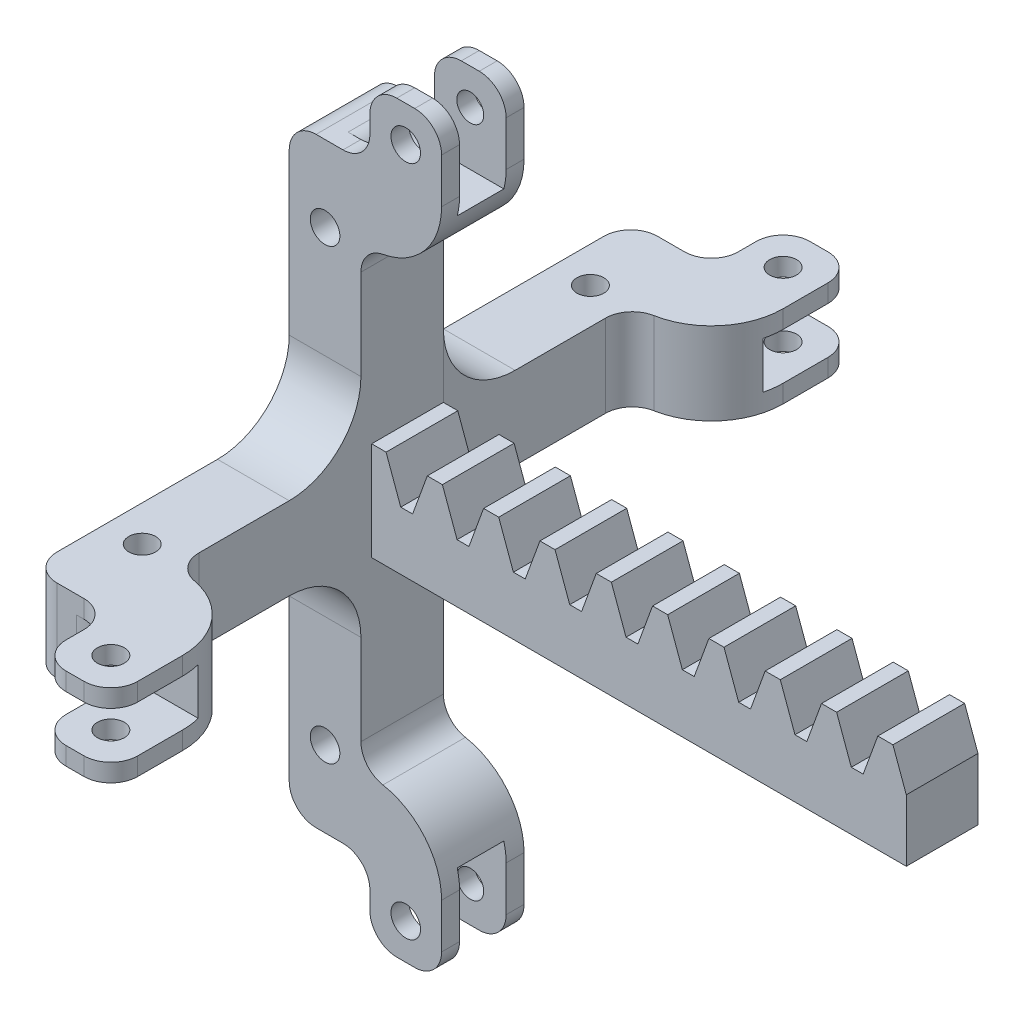
from build123d import *

# Parameters (mm, degrees)
SKETCH_1_W             = 188.495559215
SKETCH_1_H             = 10
EXTRUDE_1_DEPTH        = 5
EXTRUDE_2_DEPTH        = 5
PATTERN_LINEAR_1_COUNT = 30
PATTERN_LINEAR_1_PITCH = 6.283185307
EXTRUDE_1_2_DEPTH      = 3
SKETCH_5_W             = 188.495559215
SKETCH_5_H             = 8
CUT_EXTRUDE_1_DEPTH    = 3.5
SKETCH_6_W             = 1.321741482
SKETCH_6_H             = 6.5
CUT_EXTRUDE_2_DEPTH    = 8
SKETCH_7_W             = 8
SKETCH_7_H             = 67
EXTRUDE_2_2_DEPTH      = 8
SKETCH_8_W             = 8
SKETCH_8_H             = 67
EXTRUDE_3_DEPTH        = 1.2
SKETCH_9_R             = 1.65
CUT_EXTRUDE_3_DEPTH    = 47
SKETCH_11_W            = 90
SKETCH_11_H            = 19.43134898
CUT_EXTRUDE_5_DEPTH    = 18.5
SKETCH_12_W            = 29.528013561
SKETCH_12_H            = 12.520960887
CUT_EXTRUDE_6_DEPTH    = 18.5
FILLET_1_R             = 3
EXTRUDE_START          = -9.2
EXTRUDE_5_DEPTH        = 9.2
SKETCH_14_R            = 1.65
CUT_EXTRUDE_7_DEPTH    = 10
FILLET_2_R             = 8
FILLET_3_R             = 3
SKETCH_15_W            = 12.861039222
SKETCH_15_H            = 5.2
CUT_EXTRUDE_8_DEPTH    = 10
FILLET_4_R             = 2
FILLET_5_R             = 2
SKETCH_16_W            = 10
SKETCH_16_H            = 5.2
CUT_EXTRUDE_9_DEPTH    = 10
FILLET_6_R             = 3
FILLET_7_R             = 3
EXTRUDE_START_2        = -2
SKETCH_17_R            = 1.65
SKETCH_17_R_2          = 1.5
EXTRUDE_6_DEPTH        = 2
SKETCH_18_W            = 67
SKETCH_18_H            = 9.2
EXTRUDE_7_DEPTH        = 8
EXTRUDE_8_REACH        = 114.681
SKETCH_20_W            = 44.135426651
SKETCH_20_H            = 50.490607697
SKETCH_20_W_2          = 28.186667644
SKETCH_20_H_2          = 40.719184925
CUT_EXTRUDE_10_DEPTH   = 33
SKETCH_21_R            = 1.5
CUT_EXTRUDE_11_DEPTH   = 33
SKETCH_22_W            = 10
SKETCH_22_H            = 5.2
CUT_EXTRUDE_12_DEPTH   = 10
SKETCH_23_W            = 9
SKETCH_23_H            = 5.2
CUT_EXTRUDE_13_DEPTH   = 10
FILLET_8_R             = 3
FILLET_9_R             = 3
FILLET_10_R            = 8
FILLET_11_R            = 3
FILLET_12_R            = 8
SKETCH_24_R            = 1.5
CUT_EXTRUDE_14_DEPTH   = 10
FILLET_13_R            = 3


with BuildPart() as part:
    # 草图1 → Extrude 1 (new body)
    with BuildSketch(Plane.XY):
        with Locations((94.247779608, -5)):
            Rectangle(SKETCH_1_W, SKETCH_1_H)
    extrude(amount=EXTRUDE_1_DEPTH)

    # 草图2 → Extrude 2 (add)
    with BuildSketch(Plane.XY.offset(5)):
        Polygon((0, 0), (1.637866054, 4.5), (3.323577771, 4.5), (4.961443825, 0), align=None)
    extrude_2 = extrude(amount=-EXTRUDE_2_DEPTH)

    # 阵列(线性)1: Extrude 2 ×30
    with Locations(*[(i * PATTERN_LINEAR_1_PITCH, 0, 0) for i in range(1, PATTERN_LINEAR_1_COUNT)]):
        add(extrude_2)

    # 草图3 → Extrude 1 2 (add)
    with BuildSketch(Plane(origin=(188.495559215, -10, 0), x_dir=(-1, 0, 0), z_dir=(0, 0, -1))):
        Polygon((188.495559215, 0), (188.495559215, 10), (186.857693161, 14.5), (185.171981445, 14.5), (183.53411539, 10), (182.212373908, 10), (180.574507854, 14.5), (178.888796137, 14.5), (177.250930083, 10), (175.929188601, 10), (174.291322547, 14.5), (172.60561083, 14.5), (170.967744776, 10), (169.646003294, 10), (168.00813724, 14.5), (166.322425523, 14.5), (164.684559469, 10), (163.362817987, 10), (161.724951932, 14.5), (160.039240216, 14.5), (158.401374162, 10), (157.079632679, 10), (155.441766625, 14.5), (153.756054909, 14.5), (152.118188855, 10), (150.796447372, 10), (149.158581318, 14.5), (147.472869602, 14.5), (145.835003547, 10), (144.513262065, 10), (142.875396011, 14.5), (141.189684294, 14.5), (139.55181824, 10), (138.230076758, 10), (136.592210704, 14.5), (134.906498987, 14.5), (133.268632933, 10), (131.946891451, 10), (130.309025397, 14.5), (128.62331368, 14.5), (126.985447626, 10), (125.663706144, 10), (124.025840089, 14.5), (122.340128373, 14.5), (120.702262319, 10), (119.380520836, 10), (117.742654782, 14.5), (116.056943066, 14.5), (114.419077011, 10), (113.097335529, 10), (111.459469475, 14.5), (109.773757759, 14.5), (108.135891704, 10), (106.814150222, 10), (105.176284168, 14.5), (103.490572451, 14.5), (101.852706397, 10), (100.530964915, 10), (98.893098861, 14.5), (97.207387144, 14.5), (95.56952109, 10), (94.247779608, 10), (92.609913553, 14.5), (90.924201837, 14.5), (89.286335783, 10), (87.964594301, 10), (86.326728246, 14.5), (84.64101653, 14.5), (83.003150476, 10), (81.681408993, 10), (80.043542939, 14.5), (78.357831223, 14.5), (76.719965168, 10), (75.398223686, 10), (73.760357632, 14.5), (72.074645915, 14.5), (70.436779861, 10), (69.115038379, 10), (67.477172325, 14.5), (65.791460608, 14.5), (64.153594554, 10), (62.831853072, 10), (61.193987018, 14.5), (59.508275301, 14.5), (57.870409247, 10), (56.548667765, 10), (54.91080171, 14.5), (53.225089994, 14.5), (51.58722394, 10), (50.265482457, 10), (48.627616403, 14.5), (46.941904687, 14.5), (45.304038633, 10), (43.98229715, 10), (42.344431096, 14.5), (40.65871938, 14.5), (39.020853325, 10), (37.699111843, 10), (36.061245789, 14.5), (34.375534072, 14.5), (32.737668018, 10), (31.415926536, 10), (29.778060482, 14.5), (28.092348765, 14.5), (26.454482711, 10), (25.132741229, 10), (23.494875175, 14.5), (21.809163458, 14.5), (20.171297404, 10), (18.849555922, 10), (17.211689867, 14.5), (15.525978151, 14.5), (13.888112097, 10), (12.566370614, 10), (10.92850456, 14.5), (9.242792844, 14.5), (7.604926789, 10), (6.283185307, 10), (4.645319253, 14.5), (2.959607536, 14.5), (1.321741482, 10), (0, 10), (0, 0), align=None)
    extrude(amount=EXTRUDE_1_2_DEPTH)

    # 草图5 → 切除-拉伸1 (cut)
    with BuildSketch(Plane.XZ.offset(10)):
        with Locations((94.247779608, 1)):
            Rectangle(SKETCH_5_W, SKETCH_5_H)
    extrude(amount=-CUT_EXTRUDE_1_DEPTH, mode=Mode.SUBTRACT)

    # 草图6 → 切除-拉伸2 (cut)
    with BuildSketch(Plane(origin=(0, 0, -3), x_dir=(-1, 0, 0), z_dir=(0, 0, -1))):
        with Locations((-187.834688474, -3.25)):
            Rectangle(SKETCH_6_W, SKETCH_6_H)
    extrude(amount=-CUT_EXTRUDE_2_DEPTH, mode=Mode.SUBTRACT)

    # 草图7 → Extrude 2 2 (add)
    with BuildSketch(Plane.ZY):
        with Locations((1, -1)):
            Rectangle(SKETCH_7_W, SKETCH_7_H)
    extrude(amount=-EXTRUDE_2_2_DEPTH)

    # 草图8 → 凸台-拉伸3 (add)
    with BuildSketch(Plane.XY.offset(5)):
        with Locations((4, -1)):
            Rectangle(SKETCH_8_W, SKETCH_8_H)
    extrude(amount=EXTRUDE_3_DEPTH)

    # 草图9 → 切除-拉伸3 (cut)
    with BuildSketch(Plane.XY.offset(6.2)):
        with Locations((4, 24)):
            Circle(SKETCH_9_R)
        with Locations(Location((4, -26, 0), (0, 0, 180))):
            Circle(SKETCH_9_R)
    extrude(amount=-CUT_EXTRUDE_3_DEPTH, mode=Mode.SUBTRACT)

    # 草图11 → 切除-拉伸5 (cut)
    with BuildSketch(Plane.XY.offset(5)):
        with Locations((142.173817733, 3.21567449)):
            Rectangle(SKETCH_11_W, SKETCH_11_H)
    extrude(amount=-CUT_EXTRUDE_5_DEPTH, mode=Mode.SUBTRACT)

    # 草图12 → 切除-拉伸6 (cut)
    with BuildSketch(Plane.XY.offset(5)):
        with Locations((82.409810953, -0.239519556)):
            Rectangle(SKETCH_12_W, SKETCH_12_H)
    extrude(amount=-CUT_EXTRUDE_6_DEPTH, mode=Mode.SUBTRACT)

    # 圆角1
    fillet_1_edges = [part.edges().sort_by_distance(p)[0] for p in [
        (0, 32.5, 1.6),
        (8, -34.5, 1.6),
        (8, 32.5, 1.6),
        (0, -34.5, 1.6),
    ]]
    fillet(fillet_1_edges, radius=FILLET_1_R)

    # 草图13 → 凸台-拉伸5 (add)
    with BuildSketch(Plane.XY.offset(6.2).offset(EXTRUDE_START)):
        with BuildLine():
            Line((5, 32.5), (9, 32.5))
            Line((9, 32.5), (9, 40.5))
            Line((9, 40.5), (17, 40.5))
            Line((17, 40.5), (17, 24.5))
            Line((17, 24.5), (8, 24.5))
            Line((8, 24.5), (8, 29.5))
            ThreePointArc((8, 29.5), (7.121320344, 31.621320344), (5, 32.5))
        make_face()
        with BuildLine():
            Line((8, -31.5), (8, -26.5))
            Line((8, -26.5), (17, -26.5))
            Line((17, -26.5), (17, -42.5))
            Line((17, -42.5), (9, -42.5))
            Line((9, -42.5), (9, -34.5))
            Line((9, -34.5), (5, -34.5))
            ThreePointArc((5, -34.5), (7.121320344, -33.621320344), (8, -31.5))
        make_face()
    extrude(amount=EXTRUDE_5_DEPTH)

    # 草图14 → 切除-拉伸7 (cut)
    with BuildSketch(Plane.XY.offset(6.2)):
        with Locations((13, 36.5)):
            Circle(SKETCH_14_R)
        with Locations(Location((13, -38.5, 0), (0, 0, 180))):
            Circle(SKETCH_14_R)
    extrude(amount=-CUT_EXTRUDE_7_DEPTH, mode=Mode.SUBTRACT)

    # 圆角2
    fillet_2_edges = [part.edges().sort_by_distance(p)[0] for p in [
        (17, 24.5, 1.6),
        (17, -26.5, 1.6),
    ]]
    fillet(fillet_2_edges, radius=FILLET_2_R)

    # 圆角3
    fillet_3_edges = [part.edges().sort_by_distance(p)[0] for p in [
        (9, 32.5, 1.6),
        (9, 40.5, 1.6),
        (17, 40.5, 1.6),
        (8, 24.5, 1.6),
        (8, -26.5, 1.6),
        (9, -34.5, 1.6),
        (9, -42.5, 1.6),
        (17, -42.5, 1.6),
    ]]
    fillet(fillet_3_edges, radius=FILLET_3_R)

    # 草图15 → 切除-拉伸8 (cut)
    with BuildSketch(Plane(origin=(0, 40.5, 0), x_dir=(1, 0, 0), z_dir=(0, 1, 0))):
        with Locations((13, -1.6)):
            Rectangle(SKETCH_15_W, SKETCH_15_H)
    extrude(amount=-CUT_EXTRUDE_8_DEPTH, mode=Mode.SUBTRACT)

    # 圆角4
    # the kernel refuses this fillet: 2 mm, written as the material it takes off along each edge
    with BuildSketch(Plane(origin=(6.569480389, 32.554547219, -1), x_dir=(-0.9996282824782214, -0.02726347134245878, 0), z_dir=(0, 0, 1))) as fillet_4_piece_1:
        with BuildLine():
            CenterArc((2.055270654, 1.999256565), FILLET_4_R, 178.437724577, 90)
            Line((0.056014089, 2.053783508), (-0.143911567, 2.059236202))
            Line((-0.143911567, 2.059236202), (-0.199925656, 0.005452694))
            Line((-0.199925656, 0.005452694), (0.032597696, -0.197325594))
            ThreePointArc((0.032597696, -0.197325594), (0.565303156, -0.160924726), (1.995291017, -0.199925656))
            Line((1.995291017, -0.199925656), (2.000743711, 0))
        make_face()
    extrude(amount=5.2, mode=Mode.SUBTRACT)

    # 圆角5
    fillet_5_edges = [part.edges().sort_by_distance(p)[0] for p in [
        (6.569480389, 30.5, 1.6),
    ]]
    fillet(fillet_5_edges, radius=FILLET_5_R)

    # 草图16 → 切除-拉伸9 (cut)
    with BuildSketch(Plane.XZ.offset(42.5)):
        with Locations((13, 1.6)):
            Rectangle(SKETCH_16_W, SKETCH_16_H)
    extrude(amount=-CUT_EXTRUDE_9_DEPTH, mode=Mode.SUBTRACT)

    # 圆角6
    # the kernel refuses this fillet: 3 mm, written as the material it takes off along each edge
    with BuildSketch(Plane(origin=(8, -35.263932023, -1), x_dir=(-0.9654070298529217, 0.2607475152528977, 0), z_dir=(0, 0, 1))) as fillet_6_piece_1:
        with BuildLine():
            CenterArc((3.712019352, -2.89622109), FILLET_6_R, 105.114421668, 70.528779366)
            Line((0.720688407, -2.668319405), (0.421555313, -2.645529236))
            ThreePointArc((0.421555313, -2.645529236), (0.070722095, -1.412383957), (-0.289622109, -0.078224255))
            Line((-0.289622109, -0.078224255), (0.134776489, 0.268021078))
            ThreePointArc((0.134776489, 0.268021078), (2.051783182, 0.073611795), (2.851552552, 0.289622109))
            Line((2.851552552, 0.289622109), (2.929776806, 0))
        make_face()
    extrude(amount=5.2, mode=Mode.SUBTRACT)

    # 圆角7
    fillet_7_edges = [part.edges().sort_by_distance(p)[0] for p in [
        (8, -32.5, 1.6),
    ]]
    fillet(fillet_7_edges, radius=FILLET_7_R)

    # 草图17 → 凸台-拉伸6 (add)
    # profile 1 of 2: a face of its own
    with BuildSketch(Plane(origin=(0, 0, -3), x_dir=(-1, 0, 0), z_dir=(0, 0, -1)).offset(EXTRUDE_START_2)):
        with Locations(Location((-13, -38.5, 0), (0, 0, 180))):
            Circle(SKETCH_17_R)
        with Locations((-13, -38.5)):
            Circle(SKETCH_17_R_2, mode=Mode.SUBTRACT)
    # profile 2 of 2: a face of its own
    with BuildSketch(Plane(origin=(0, 0, -3), x_dir=(-1, 0, 0), z_dir=(0, 0, -1)).offset(EXTRUDE_START_2)):
        with Locations(Location((-13, 36.5, 0), (0, 0, 180))):
            Circle(SKETCH_17_R)
        with Locations((-13, 36.5)):
            Circle(SKETCH_17_R_2, mode=Mode.SUBTRACT)
    extrude(amount=EXTRUDE_6_DEPTH)

    # 草图18 → 凸台-拉伸7 (add)
    with BuildSketch(Plane.ZY):
        with Locations((1.6, -1)):
            Rectangle(SKETCH_18_W, SKETCH_18_H)
    extrude(amount=-EXTRUDE_7_DEPTH)

    # 凸台-拉伸8: up to this face of the body (flat: up to its plane)
    extrude_8_end = Plane(part.part.faces().sort_by_distance((4, 3.6, 20.65))[0])
    # 草图19 → 凸台-拉伸8 (add, up to the picked face)
    with BuildSketch(Plane.XZ.offset(42.5), mode=Mode.PRIVATE) as extrude_8_sk1:
        Polygon((9, -39.9), (17, -39.9), (17, -23.9), (9, -23.9), (8, -23.9), (8, -31.9), (9, -31.9), align=None)
    extrude_8_tool1 = split(extrude(extrude_8_sk1.sketch, amount=-EXTRUDE_8_REACH, mode=Mode.PRIVATE), bisect_by=extrude_8_end, keep=Keep.BOTH, mode=Mode.PRIVATE)
    # 草图19 → 凸台-拉伸8 (add, up to the picked face)
    with BuildSketch(Plane.XZ.offset(42.5), mode=Mode.PRIVATE) as extrude_8_sk2:
        Polygon((9, 35.1), (9, 43.1), (17, 43.1), (17, 27.1), (9, 27.1), (8, 27.1), (8, 35.1), align=None)
    extrude_8_tool2 = split(extrude(extrude_8_sk2.sketch, amount=-EXTRUDE_8_REACH, mode=Mode.PRIVATE), bisect_by=extrude_8_end, keep=Keep.BOTH, mode=Mode.PRIVATE)
    add(extrude_8_tool1.solids().sort_by(Axis((12.735294, -42.5, -31.664706), (0, 1, 0)))[0])
    add(extrude_8_tool2.solids().sort_by(Axis((12.735294, -42.5, 34.864706), (0, 1, 0)))[0])

    # 草图20 → 切除-拉伸10 (cut)
    with BuildSketch(Plane.ZY):
        with Locations((-45.967713326, -30.845303849)):
            Rectangle(SKETCH_20_W, SKETCH_20_H)
        with Locations((41.193333822, -25.959592463)):
            Rectangle(SKETCH_20_W_2, SKETCH_20_H_2)
    extrude(amount=-CUT_EXTRUDE_10_DEPTH, mode=Mode.SUBTRACT)

    # 草图21 → 切除-拉伸11 (cut)
    with BuildSketch(Plane.XZ.offset(5.6)):
        with Locations((13, 39.1)):
            Circle(SKETCH_21_R)
        with Locations(Location((13, -35.9, 0), (0, 0, 180))):
            Circle(SKETCH_21_R)
    extrude(amount=-CUT_EXTRUDE_11_DEPTH, mode=Mode.SUBTRACT)

    # 草图22 → 切除-拉伸12 (cut)
    with BuildSketch(Plane.XY.offset(43.1)):
        with Locations((13, -1)):
            Rectangle(SKETCH_22_W, SKETCH_22_H)
    extrude(amount=-CUT_EXTRUDE_12_DEPTH, mode=Mode.SUBTRACT)

    # 草图23 → 切除-拉伸13 (cut)
    with BuildSketch(Plane(origin=(0, 0, -39.9), x_dir=(-1, 0, 0), z_dir=(0, 0, -1))):
        with Locations((-12.5, -1)):
            Rectangle(SKETCH_23_W, SKETCH_23_H)
    extrude(amount=-CUT_EXTRUDE_13_DEPTH, mode=Mode.SUBTRACT)

    # 圆角8
    # the kernel refuses this fillet: 3 mm, written as the material it takes off along each edge
    with BuildSketch(Plane(origin=(8, 1.6, -31.9), x_dir=(-1, 0, 0), z_dir=(0, -1, 0))) as fillet_8_piece_1:
        with BuildLine():
            CenterArc((2.828427125, -3), FILLET_8_R, 90, 70.528779366)
            Line((0, -2), (0, 0))
            Line((0, 0), (2.828427125, 0))
        make_face()
    extrude(amount=5.2, mode=Mode.SUBTRACT)
    with BuildSketch(Plane(origin=(8, 1.6, 35.1), x_dir=(-1, 0, 0), z_dir=(0, -1, 0))) as fillet_8_piece_2:
        with BuildLine():
            CenterArc((2.828427125, 3), FILLET_8_R, 199.471220634, 70.528779366)
            Line((0, 2), (0, 0))
            Line((0, 0), (2.828427125, 0))
        make_face()
    extrude(amount=5.2, mode=Mode.SUBTRACT)
    with BuildSketch(Plane(origin=(9, -5.9, 43.1), x_dir=(0, 0, -1), z_dir=(0, 1, 0)), Plane(origin=(9, -13.1, 43.1), x_dir=(0, 0, -1), z_dir=(0, 1, 0)), Plane(origin=(17, -13.1, 43.1), x_dir=(-1, 0, 0), z_dir=(0, 1, 0)), Plane(origin=(17, -13.1, -39.9), x_dir=(0, 0, 1), z_dir=(0, 1, 0))) as fillet_8_piece_3:
        with BuildLine():
            CenterArc((FILLET_8_R, -FILLET_8_R), FILLET_8_R, 90, 90)
            Line((0, -FILLET_8_R), (0, 0))
            Line((0, 0), (FILLET_8_R, 0))
        make_face()
    extrude(amount=17, mode=Mode.SUBTRACT)
    with BuildSketch(Plane(origin=(17, -5.9, 43.1), x_dir=(0, 0, -1), z_dir=(0, 1, 0)), Plane(origin=(9, -5.9, -39.9), x_dir=(0, 0, 1), z_dir=(0, 1, 0)), Plane(origin=(9, -13.1, -39.9), x_dir=(0, 0, 1), z_dir=(0, 1, 0)), Plane(origin=(17, -5.9, -39.9), x_dir=(-1, 0, 0), z_dir=(0, 1, 0))) as fillet_8_piece_4:
        with BuildLine():
            CenterArc((FILLET_8_R, FILLET_8_R), FILLET_8_R, 180, 90)
            Line((0, FILLET_8_R), (0, 0))
            Line((0, 0), (FILLET_8_R, 0))
        make_face()
    extrude(amount=17, mode=Mode.SUBTRACT)
    with BuildSketch(Plane(origin=(0, -13.1, -31.9), x_dir=(0, 0, 1), z_dir=(0, 1, 0)), Plane(origin=(0, 11.1, 35.1), x_dir=(0, 0, -1), z_dir=(0, -1, 0))) as fillet_8_piece_5:
        with BuildLine():
            CenterArc((FILLET_8_R, FILLET_8_R), FILLET_8_R, 180, 90)
            Line((0, FILLET_8_R), (0, 0))
            Line((0, 0), (FILLET_8_R, 0))
        make_face()
    extrude(amount=24.2, mode=Mode.SUBTRACT)

    # 圆角9
    fillet_9_edges = [part.edges().sort_by_distance(p)[0] for p in [
        (8, -1, 33.1),
        (8, -1, -29.9),
    ]]
    fillet(fillet_9_edges, radius=FILLET_9_R)

    # 圆角10
    # the kernel refuses this fillet: 8 mm, written as the material it takes off along each edge
    with BuildSketch(Plane(origin=(17, -25.6, -23.9), x_dir=(0, 0, -1), z_dir=(0, 1, 0))) as fillet_10_piece_1:
        with BuildLine():
            CenterArc((FILLET_10_R, FILLET_10_R), FILLET_10_R, 180, 90)
            Line((0, FILLET_10_R), (0, 0))
            Line((0, 0), (FILLET_10_R, 0))
        make_face()
    extrude(amount=49.2, mode=Mode.SUBTRACT)
    with BuildSketch(Plane(origin=(17, -25.6, 27.1), x_dir=(0, 0, 1), z_dir=(0, 1, 0))) as fillet_10_piece_2:
        with BuildLine():
            CenterArc((FILLET_10_R, -FILLET_10_R), FILLET_10_R, 90, 90)
            Line((0, -FILLET_10_R), (0, 0))
            Line((0, 0), (FILLET_10_R, 0))
        make_face()
    extrude(amount=49.2, mode=Mode.SUBTRACT)

    # 圆角11
    fillet_11_edges = [part.edges().sort_by_distance(p)[0] for p in [
        (8, -1, -23.9),
        (8, -1, 27.1),
    ]]
    fillet(fillet_11_edges, radius=FILLET_11_R)

    # 圆角12
    # the kernel refuses this fillet: 8 mm, written as the material it adds along each edge
    with BuildSketch(Plane(origin=(8, 3.6, 6.2), x_dir=(0, 0, 1), z_dir=(-1, 0, 0)), Plane(origin=(0, -5.6, 6.2), x_dir=(0, 0, 1), z_dir=(1, 0, 0)), Plane(origin=(0, -5.6, -3), x_dir=(0, -1, 0), z_dir=(1, 0, 0)), Plane(origin=(8, 3.6, -3), x_dir=(0, 1, 0), z_dir=(-1, 0, 0))) as fillet_12_piece_1:
        with BuildLine():
            CenterArc((FILLET_12_R, FILLET_12_R), FILLET_12_R, 180, 90)
            Line((0, FILLET_12_R), (0, 0))
            Line((0, 0), (FILLET_12_R, 0))
        make_face()
    extrude(amount=8)

    # 草图24 → 切除-拉伸14 (cut)
    with BuildSketch(Plane(origin=(0, 3.6, 0), x_dir=(1, 0, 0), z_dir=(0, 1, 0))):
        with Locations(Location((4, 23.4, 0), (0, 0, 180))):
            Circle(SKETCH_24_R)
        with Locations((4, -26.6)):
            Circle(SKETCH_24_R)
    extrude(amount=-CUT_EXTRUDE_14_DEPTH, mode=Mode.SUBTRACT)

    # 圆角13
    fillet_13_edges = [part.edges().sort_by_distance(p)[0] for p in [
        (9, 2.6, -31.9),
        (9, 2.6, 35.1),
        (9, -4.6, 35.1),
        (9, -4.6, -31.9),
    ]]
    fillet(fillet_13_edges, radius=FILLET_13_R)


solid = part.part
